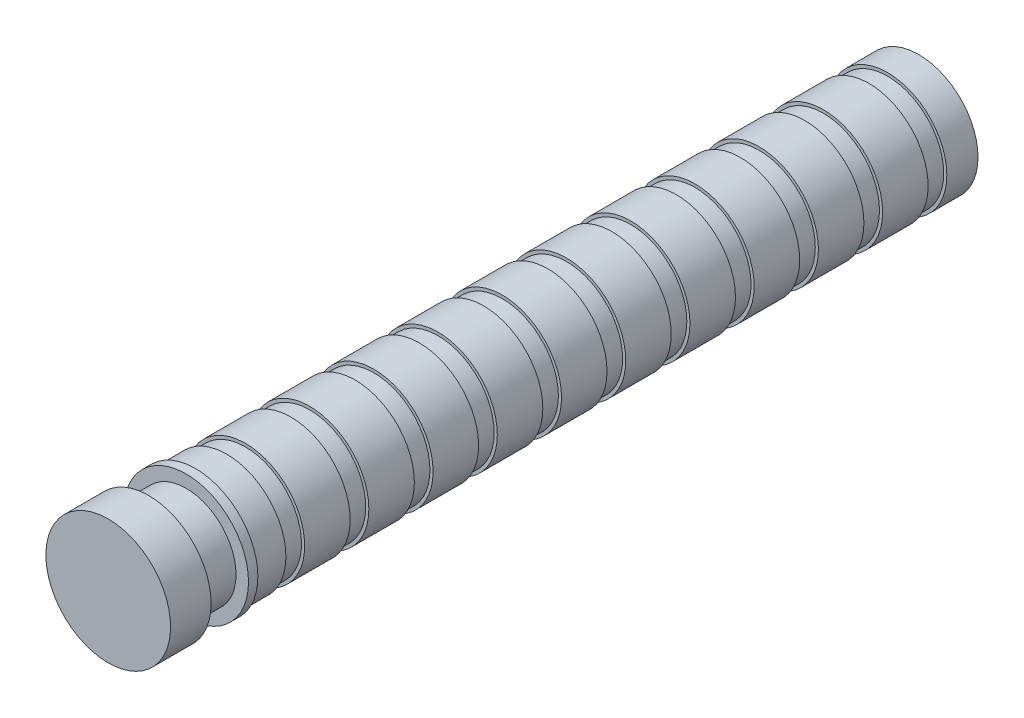
from build123d import *

# Parameters (mm, degrees)
CUT_EXTRUDE1_DEPTH = 14


with BuildPart() as part:
    # Sketch2 → Revolve2 (revolve)
    with BuildSketch(Plane(origin=(0, 0, 0), x_dir=(0, 0, -1), z_dir=(1, 0, 0))):
        Polygon((-29, 0), (29, 0), (29, 4.75), (26.5, 4.75), (26.5, 4.5), (25, 4.5), (25, 4.75), (21.35, 4.75), (21.35, 4.5), (19.85, 4.5), (19.85, 4.75), (16.2, 4.75), (16.2, 4.5), (14.7, 4.5), (14.7, 4.75), (11.05, 4.75), (11.05, 4.5), (9.55, 4.5), (9.55, 4.75), (5.9, 4.75), (5.9, 4.5), (4.4, 4.5), (4.4, 4.75), (0.75, 4.75), (0.75, 4.5), (-0.75, 4.5), (-0.75, 4.75), (-4.4, 4.75), (-4.4, 4.5), (-5.9, 4.5), (-5.9, 4.75), (-9.55, 4.75), (-9.55, 4.5), (-11.05, 4.5), (-11.05, 4.75), (-14.7, 4.75), (-14.7, 4.5), (-16.2, 4.5), (-16.2, 4.75), (-19.85, 4.75), (-19.85, 4.5), (-21.35, 4.5), (-21.35, 4.75), (-25, 4.75), (-25, 4.5), (-26.5, 4.5), (-26.5, 4.75), (-29, 4.75), (-29, 5), (-29.75, 5), (-29.75, 4), (-32.75, 4), (-32.75, 5), (-36, 5), (-36, 0), align=None)
    revolve(axis=Axis((0, 0, -29), (0, 0, -1)))

    # Sketch3 → Cut-Extrude1 (cut)
    with BuildSketch(Plane(origin=(0, 0, -29), x_dir=(-1, 0, 0), z_dir=(0, 0, -1))):
        with BuildLine():
            Line((1.75, 0.968245837), (1.75, -0.968245837))
            ThreePointArc((1.75, -0.968245837), (-2, 0), (1.75, 0.968245837))
        make_face()
    extrude(amount=-CUT_EXTRUDE1_DEPTH, mode=Mode.SUBTRACT)


solid = part.part
